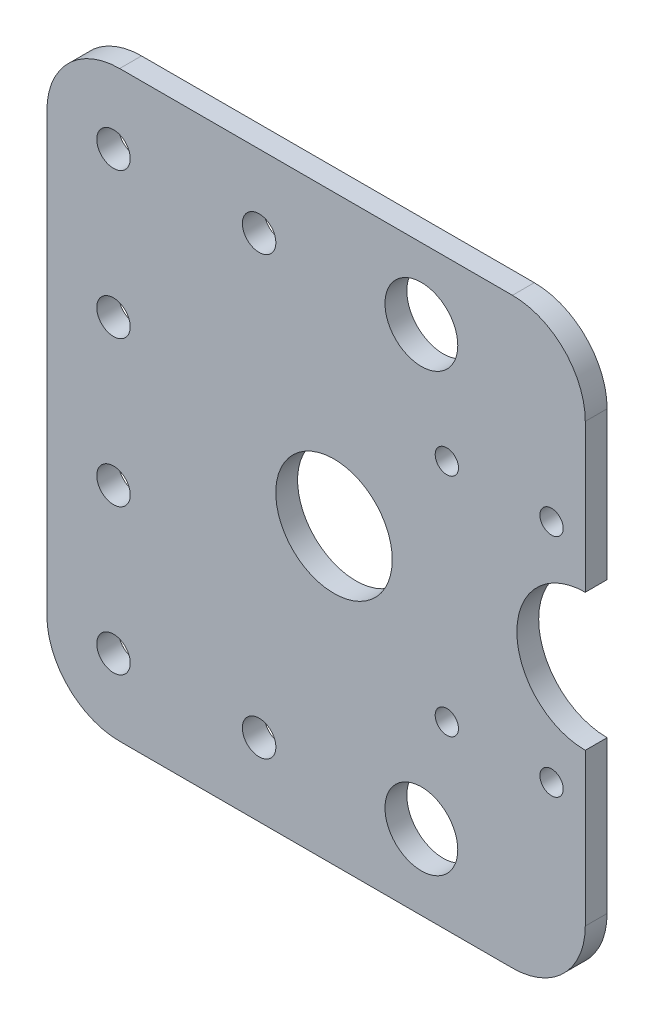
from build123d import *

# Parameters (mm, degrees)
SKETCH1_R           = 2.3
SKETCH1_R_2         = 1.6
SKETCH1_R_3         = 8
SKETCH1_R_4         = 5
BOSS_EXTRUDE1_DEPTH = 3


with BuildPart() as part:
    # Sketch1 → Boss-Extrude1 (new body)
    with BuildSketch(Plane.XY):
        with BuildLine():
            Line((157.960700719, -71.866196008), (170.473892307, -71.866196008))
            ThreePointArc((170.473892307, -71.866196008), (177.544960119, -74.795128196), (180.473892307, -81.866196008))
            Line((180.473892307, -81.866196008), (180.473892307, -102.193954741))
            ThreePointArc((180.473892307, -102.193954741), (171.076134746, -111.591712302), (180.473892307, -120.989469864))
            Line((180.473892307, -120.989469864), (180.473892307, -141.896756479))
            ThreePointArc((180.473892307, -141.896756479), (177.544960119, -148.967824291), (170.473892307, -151.896756479))
            Line((170.473892307, -151.896756479), (157.960700719, -151.896756479))
            Line((157.960700719, -151.896756479), (116.525823666, -151.896756479))
            ThreePointArc((116.525823666, -151.896756479), (109.454755854, -148.967824291), (106.525823666, -141.896756479))
            Line((106.525823666, -141.896756479), (106.525823666, -81.866196008))
            ThreePointArc((106.525823666, -81.866196008), (109.454755854, -74.795128196), (116.525823666, -71.866196008))
            Line((116.525823666, -71.866196008), (157.960700719, -71.866196008))
        make_face()
        with Locations((115.674612816, -101.866196008)):
            Circle(SKETCH1_R, mode=Mode.SUBTRACT)
        with Locations((115.674612816, -121.866196008)):
            Circle(SKETCH1_R, mode=Mode.SUBTRACT)
        with Locations((135.674612816, -141.866196008)):
            Circle(SKETCH1_R, mode=Mode.SUBTRACT)
        with Locations((135.674612816, -81.866196008)):
            Circle(SKETCH1_R, mode=Mode.SUBTRACT)
        with Locations((115.674612816, -81.866196008)):
            Circle(SKETCH1_R, mode=Mode.SUBTRACT)
        with Locations((115.674612816, -141.866196008)):
            Circle(SKETCH1_R, mode=Mode.SUBTRACT)
        with Locations((161.460700719, -96.114221831)):
            Circle(SKETCH1_R_2, mode=Mode.SUBTRACT)
        with Locations((161.460700719, -127.114221831)):
            Circle(SKETCH1_R_2, mode=Mode.SUBTRACT)
        with Locations((145.960700719, -111.591712302)):
            Circle(SKETCH1_R_3, mode=Mode.SUBTRACT)
        with Locations((175.843347401, -96.114221831)):
            Circle(SKETCH1_R_2, mode=Mode.SUBTRACT)
        with Locations((157.960700719, -81.591712302)):
            Circle(SKETCH1_R_4, mode=Mode.SUBTRACT)
        with Locations((157.960700719, -141.591712302)):
            Circle(SKETCH1_R_4, mode=Mode.SUBTRACT)
        with Locations((175.843347401, -127.114221831)):
            Circle(SKETCH1_R_2, mode=Mode.SUBTRACT)
    extrude(amount=BOSS_EXTRUDE1_DEPTH)


solid = part.part
